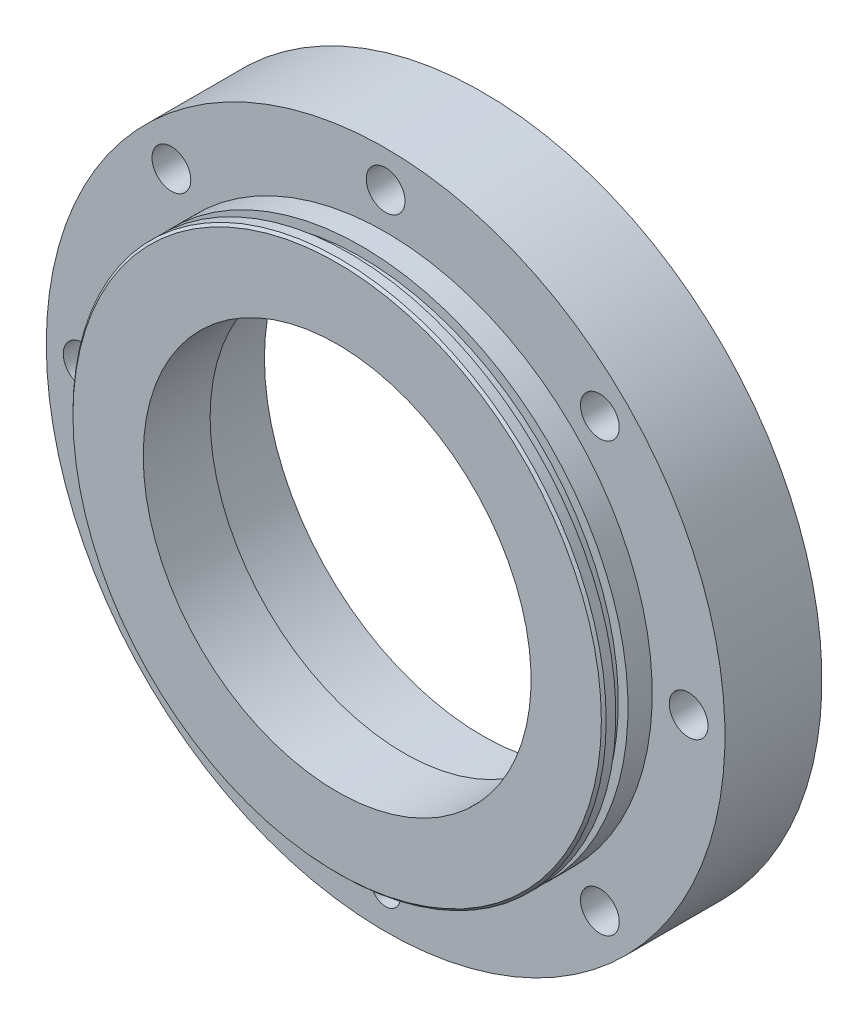
from build123d import *

# Parameters (mm, degrees)
SKETCH2_R             = 3
CUT_EXTRUDE1_DEPTH    = 9
SKETCH3_R             = 4
CUT_EXTRUDE2_DEPTH    = 10
F_8_0MM_DOWEL_HOLE1_D = 8
SKETCH9_W             = 2
SKETCH9_H             = 2.5
CHAMFER1_SIZE         = 0.5


with BuildPart() as part:
    # Sketch1 → Revolve1 (revolve)
    with BuildSketch(Plane(origin=(0, 0, 0), x_dir=(1, 0, 0), z_dir=(0, 1, 0))):
        Polygon((-55, -19.79575879), (-55, -9.79575879), (-70, -9.79575879), (-70, 10.20424121), (-45, 10.20424121), (-45, -6), (-40, -6), (-40, -19.79575879), align=None)
    revolve(axis=Axis((0, 0, -52.707374268), (0, 0, 1)))

    # Sketch2 → Cut-Extrude1 (cut)
    with BuildSketch(Plane.XY.offset(9.79575879)):
        with Locations((0, -62.5)):
            Circle(SKETCH2_R)
    extrude(amount=-CUT_EXTRUDE1_DEPTH, mode=Mode.SUBTRACT)

    # Sketch3 → Cut-Extrude2 (cut)
    with BuildSketch(Plane.XY.offset(9.79575879)):
        with Locations((0, 62.5)):
            Circle(SKETCH3_R)
    extrude(amount=-CUT_EXTRUDE2_DEPTH, mode=Mode.SUBTRACT)

    # Ø8.0mm Dowel Hole1 (through all)
    with Locations(Plane.XY.offset(9.79575879)):
        with Locations((44.194173824, 44.194173824), (62.5, 0), (44.194173824, -44.194173824), (-44.194173824, -44.194173824), (-62.5, 0), (-44.194173824, 44.194173824)):
            Hole(F_8_0MM_DOWEL_HOLE1_D / 2)

    # Sketch9 → Oring groove (revolve, cut)
    with BuildSketch(Plane(origin=(0, 0, 0), x_dir=(1, 0, 0), z_dir=(0, 1, 0))):
        with Locations((-54, -16.04575879)):
            Rectangle(SKETCH9_W, SKETCH9_H)
    revolve(axis=Axis((0, 0, -11.30771881), (0, 0, 1)), mode=Mode.SUBTRACT)

    # Chamfer1
    chamfer1_edges = [part.edges().sort_by_distance(p)[0] for p in [
        (55, 0, 19.79575879),
    ]]
    chamfer(chamfer1_edges, length=CHAMFER1_SIZE)


solid = part.part
